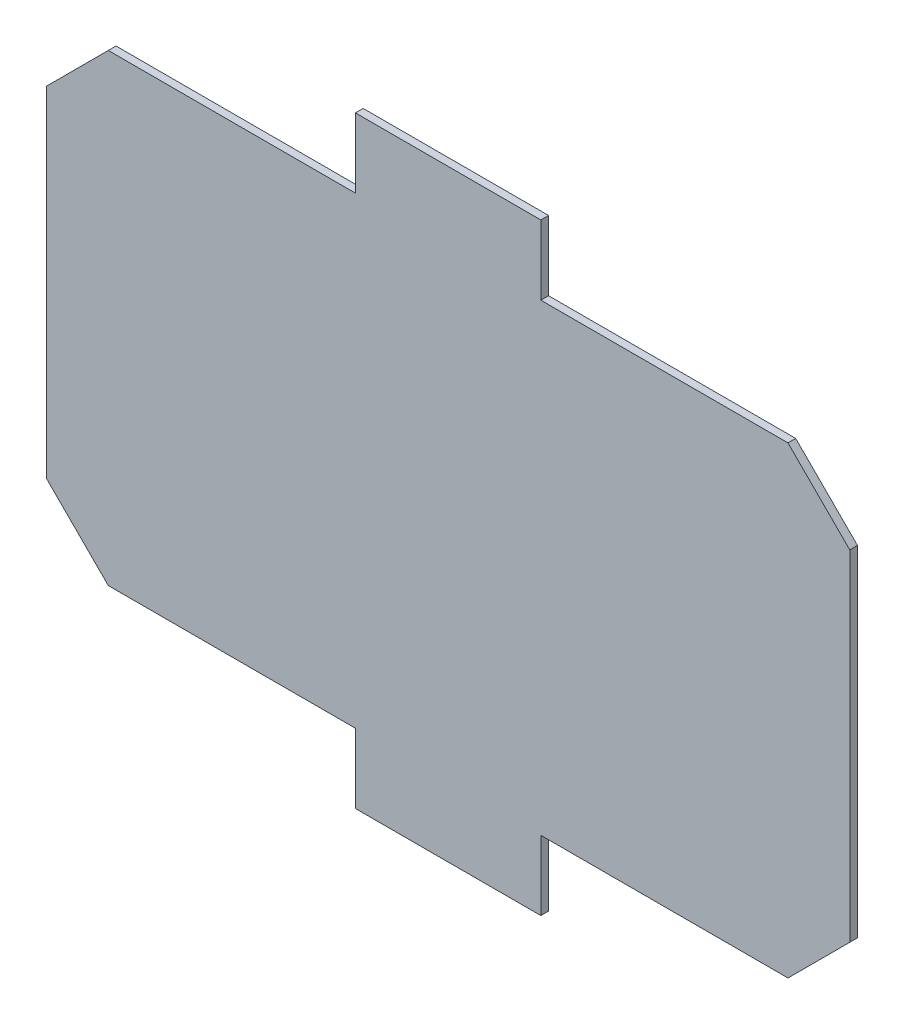
from build123d import *

# Parameters (mm, degrees)
BOSS_EXTRUDE1_DEPTH = 5
CHAMFER1_SIZE       = 40
SKETCH2_W           = 120
SKETCH2_H           = 25
CUT_EXTRUDE1_DEPTH  = 25


with BuildPart() as part:
    # Sketch1 → Boss-Extrude1 (new body)
    with BuildSketch(Plane.XY):
        Polygon((-60, 25), (-60, -45), (60, -45), (60, 25), (260, 25), (260, 325), (60, 325), (60, 395), (-60, 395), (-60, 325), (-260, 325), (-260, 25), align=None)
    extrude(amount=BOSS_EXTRUDE1_DEPTH)

    # Chamfer1
    chamfer1_edges = [part.edges().sort_by_distance(p)[0] for p in [
        (260, 25, 2.5),
        (260, 325, 2.5),
        (-260, 325, 2.5),
        (-260, 25, 2.5),
    ]]
    chamfer(chamfer1_edges, length=CHAMFER1_SIZE)

    # Sketch2 → Cut-Extrude1 (cut)
    with BuildSketch(Plane.XY.offset(5)):
        with Locations((0, 382.5)):
            Rectangle(SKETCH2_W, SKETCH2_H)
        with Locations((0, -32.5)):
            Rectangle(SKETCH2_W, SKETCH2_H)
    extrude(amount=-CUT_EXTRUDE1_DEPTH, mode=Mode.SUBTRACT)


solid = part.part
